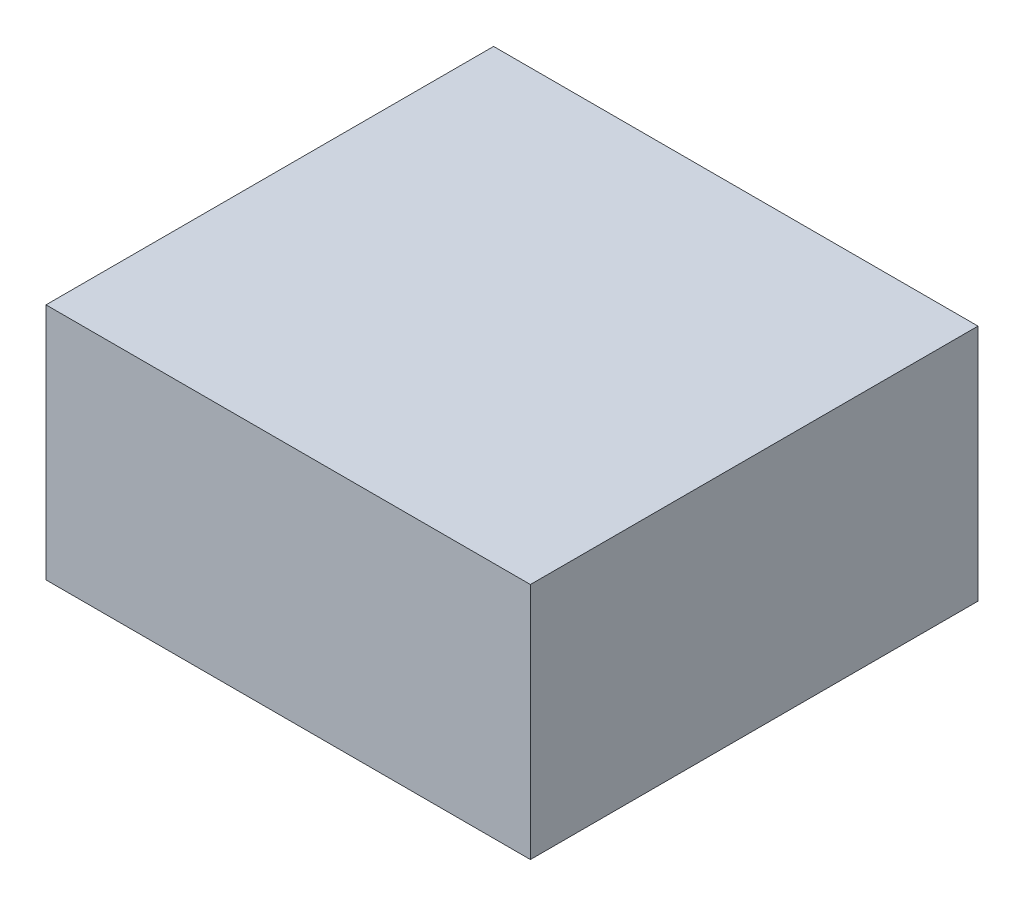
from build123d import *

# Parameters (mm, degrees)
SKETCH1_W           = 154.432
SKETCH1_H           = 142.6972
BOSS_EXTRUDE1_DEPTH = 75.946


with BuildPart() as part:
    # Sketch1 → Boss-Extrude1 (new body)
    with BuildSketch(Plane(origin=(0, 0, 0), x_dir=(1, 0, 0), z_dir=(0, 1, 0))):
        Rectangle(SKETCH1_W, SKETCH1_H)
    extrude(amount=BOSS_EXTRUDE1_DEPTH)


solid = part.part
